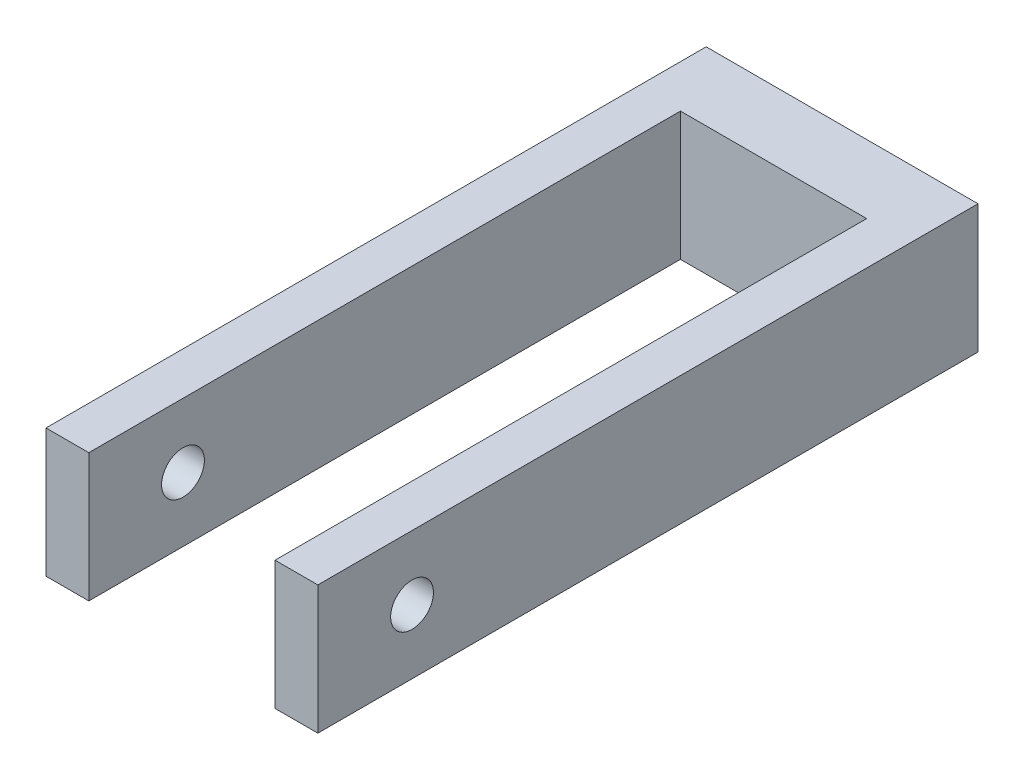
from build123d import *

# Parameters (mm, degrees)
SKETCH1_W           = 31.75
SKETCH1_H           = 15
BOSS_EXTRUDE1_DEPTH = 8
SKETCH2_W           = 5
SKETCH2_H           = 15
BOSS_EXTRUDE2_DEPTH = 69.1
SKETCH3_R           = 2.5
CUT_EXTRUDE1_DEPTH  = 69.1
SKETCH4_R           = 4
SKETCH4_R_2         = 2
CUT_EXTRUDE3_DEPTH  = 4
SKETCH5_R           = 1.5
CUT_EXTRUDE4_DEPTH  = 3


with BuildPart() as part:
    # Sketch1 → Boss-Extrude1 (new body)
    with BuildSketch(Plane.XY):
        with Locations((-0.926352113, 0.669031185)):
            Rectangle(SKETCH1_W, SKETCH1_H)
    extrude(amount=BOSS_EXTRUDE1_DEPTH)

    # Sketch2 → Boss-Extrude2 (add)
    with BuildSketch(Plane.XY.offset(8)):
        with Locations((-14.301352113, 0.669031185)):
            Rectangle(SKETCH2_W, SKETCH2_H)
        with Locations((12.448647887, 0.669031185)):
            Rectangle(SKETCH2_W, SKETCH2_H)
    extrude(amount=BOSS_EXTRUDE2_DEPTH)

    # Sketch3 → Cut-Extrude1 (cut)
    with BuildSketch(Plane(origin=(14.948647887, 0, 0), x_dir=(0, 0, -1), z_dir=(1, 0, 0))):
        with Locations((-66.1, 0.669031185)):
            Circle(SKETCH3_R)
    extrude(amount=-CUT_EXTRUDE1_DEPTH, mode=Mode.SUBTRACT)

    # Sketch4 → Cut-Extrude3 (cut)
    with BuildSketch(Plane(origin=(0, 0, 0), x_dir=(-1, 0, 0), z_dir=(0, 0, -1))):
        with Locations((0.926352113, 0.669031185)):
            Circle(SKETCH4_R)
        with Locations((0.926352113, 0.669031185)):
            Circle(SKETCH4_R_2, mode=Mode.SUBTRACT)
    extrude(amount=-CUT_EXTRUDE3_DEPTH, mode=Mode.SUBTRACT)

    # Sketch5 → Cut-Extrude4 (cut)
    with BuildSketch(Plane.XZ.offset(6.830968815)):
        with Locations((-0.926352113, 4)):
            Circle(SKETCH5_R)
    extrude(amount=-CUT_EXTRUDE4_DEPTH, mode=Mode.SUBTRACT)


solid = part.part
